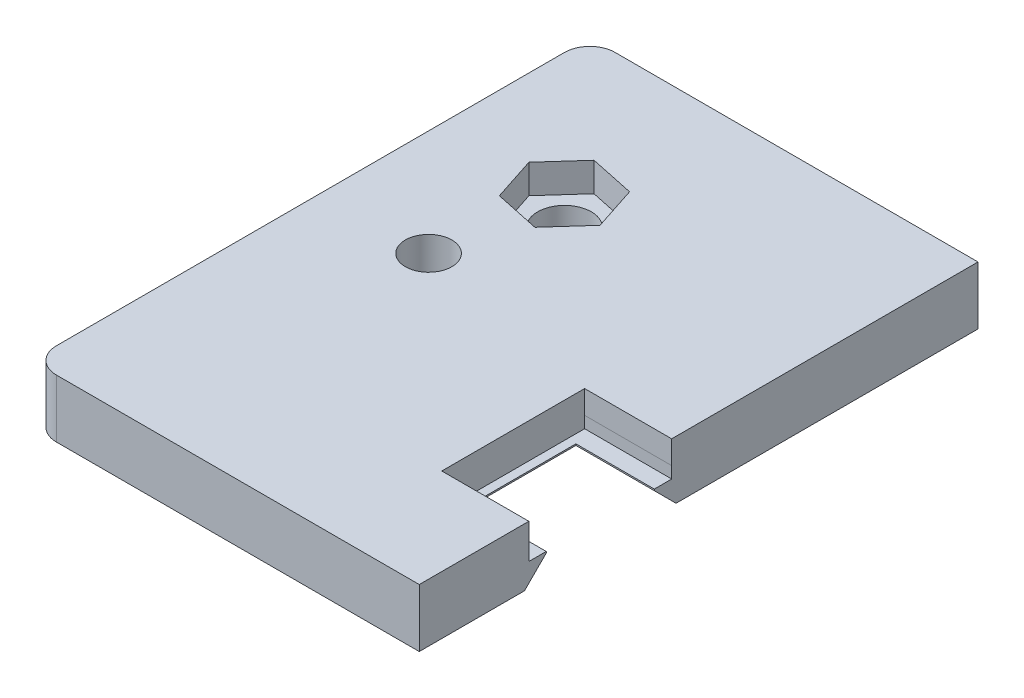
from build123d import *

# Parameters (mm, degrees)
BOSS_EXTRUDE1_DEPTH = 4
SKETCH2_W           = 9.844621866
SKETCH2_H           = 0.8
CUT_EXTRUDE1_DEPTH  = 6
SKETCH3_W           = 9.843082996
SKETCH3_H           = 1.6
CUT_EXTRUDE2_DEPTH  = 6
SKETCH5_R           = 1.6
CUT_EXTRUDE4_DEPTH  = 4
FILLET1_R           = 1.75
SKETCH10_R          = 1.85
CUT_EXTRUDE7_DEPTH  = 4
CAVITY2_START       = 2
CAVITY2_OUTLINE_R   = 1.85
CAVITY2_DEPTH       = 3


with BuildPart() as part:
    # Sketch1 → Boss-Extrude1 (new body)
    with BuildSketch(Plane(origin=(0, 0, 0), x_dir=(1, 0, 0), z_dir=(0, 1, 0))):
        Polygon((26.75, 16.194621866), (26.75, 38.5), (0, 38.5), (0, 0), (26.75, 0), (26.75, 8.75), (21.35, 8.75), (21.35, 16.194621866), align=None)
    extrude(amount=BOSS_EXTRUDE1_DEPTH)

    # Sketch2 → Cut-Extrude1 (cut)
    with BuildSketch(Plane(origin=(26.75, 0, 0), x_dir=(0, 0, -1), z_dir=(1, 0, 0))):
        with Locations((12.472310933, 2)):
            Rectangle(SKETCH2_W, SKETCH2_H)
    extrude(amount=-CUT_EXTRUDE1_DEPTH, mode=Mode.SUBTRACT)

    # Sketch3 → Cut-Extrude2 (cut)
    with BuildSketch(Plane(origin=(26.75, 0, 0), x_dir=(0, 0, -1), z_dir=(1, 0, 0))):
        with Locations((12.471541498, 3.2)):
            Rectangle(SKETCH3_W, SKETCH3_H)
    extrude(amount=-CUT_EXTRUDE2_DEPTH, mode=Mode.SUBTRACT)

    # Sketch5 → Cut-Extrude4 (cut)
    with BuildSketch(Plane(origin=(0, 4, 0), x_dir=(1, 0, 0), z_dir=(0, 1, 0))):
        with Locations(Location((7.307, 20.085, 0), (0, 0, 270))):
            Circle(SKETCH5_R)
    extrude(amount=-CUT_EXTRUDE4_DEPTH, mode=Mode.SUBTRACT)

    # Chamfer1: read off the stored shape, not the designer's step
    # Chamfer1: loft between two sections, ruled curve by curve
    chamfer1_from = [
        Edge.make_line((21.35, 1.5, -16.194621866), (21.35, 1.5, -8.75)),
        Edge.make_line((21.35, 1.5, -8.75), (26.75, 1.5, -8.75)),
        Edge.make_line((21.35, 1.5, -16.194621866), (26.75, 1.5, -16.194621866)),
        Edge.make_line((26.75, 1.5, -16.194621866), (26.75, 1.5, -8.75)),
    ]
    chamfer1_to = [
        Edge.make_line((19.85, 0, -17.694621866), (19.85, 0, -7.25)),
        Edge.make_line((19.85, 0, -7.25), (26.75, 0, -7.25)),
        Edge.make_line((19.85, 0, -17.694621866), (26.75, 0, -17.694621866)),
        Edge.make_line((26.75, 0, -17.694621866), (26.75, 0, -7.25)),
    ]
    chamfer1 = Solid(Shell([*[Face.make_surface_from_curves(chamfer1_from[k], chamfer1_to[k]) for k in range(4)], Face(Wire(chamfer1_from)), Face(Wire(chamfer1_to))]))
    add(chamfer1, mode=Mode.SUBTRACT)

    # Fillet1
    fillet1_edges = [part.edges().sort_by_distance(p)[0] for p in [
        (0, 2, -38.5),
        (0, 2, 0),
    ]]
    fillet(fillet1_edges, radius=FILLET1_R)

    # Sketch10 → Cut-Extrude7 (cut)
    with BuildSketch(Plane(origin=(0, 0, 0), x_dir=(-1, 0, 0), z_dir=(0, -1, 0))):
        with Locations(Location((-8.434644349, 28.321384576, 0), (0, 0, 90))):
            Circle(SKETCH10_R)
    extrude(amount=-CUT_EXTRUDE7_DEPTH, mode=Mode.SUBTRACT)

    # Cavity2: read off the stored shape, not the designer's step
    # Cavity2 outline → Cavity2 (cut)
    with BuildSketch(Plane(origin=(0, 0, 0), x_dir=(1, 0, 0), z_dir=(0, 1, 0)).offset(CAVITY2_START)):
        Polygon((11.54125505, 27.663886828), (10.557359451, 30.683039489), (7.450748751, 31.340537236), (5.328033648, 28.978882323), (6.311929246, 25.959729663), (9.418539947, 25.302231916), align=None)
        with Locations((8.434644349, 28.321384576)):
            Circle(CAVITY2_OUTLINE_R, mode=Mode.SUBTRACT)
    extrude(amount=CAVITY2_DEPTH, mode=Mode.SUBTRACT)


solid = part.part
